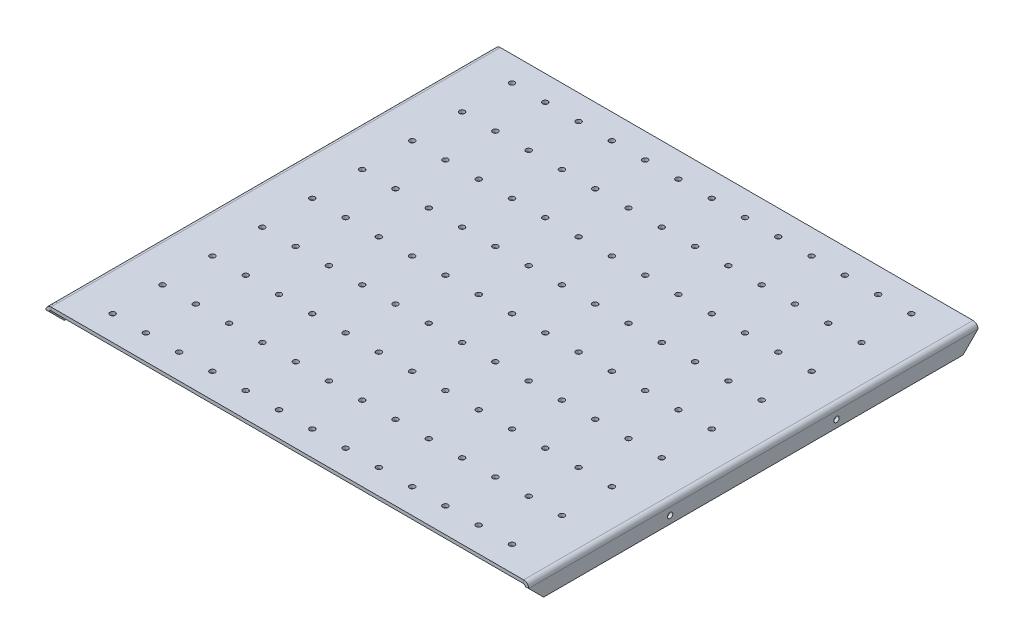
from build123d import *

# Parameters (mm, degrees)
SKETCH1_W                      = 290
SKETCH1_H                      = 270
SKETCH1_R                      = 1.6
BOSS_EXTRUDE1_DEPTH            = 2
EDGE_FLANGE1_STRIP_W           = 10
EDGE_FLANGE1_STRIP_H           = 2
EDGE_FLANGE1_STRIP_CUT_DEPTH   = 270
EDGE_FLANGE1_STRIP_2_W         = 10
EDGE_FLANGE1_STRIP_2_H         = 2
EDGE_FLANGE1_STRIP_CUT_2_DEPTH = 270
EDGE_FLANGE1_DEPTH             = 270
EDGE_FLANGE1_BEND_DEPTH        = 270
SKETCH12_R                     = 1.6
CUT_EXTRUDE1_DEPTH             = 321.039060116
CHAMFER1_SIZE                  = 9


# Sheet-metal steps are written as plain solids
with BuildPart() as part:
    # Sketch1 → Boss-Extrude1 (new body)
    with BuildSketch(Plane(origin=(0, 0, 0), x_dir=(1, 0, 0), z_dir=(0, 1, 0))):
        Rectangle(SKETCH1_W, SKETCH1_H)
        with Locations(Location((-120, 120, 0), (0, 0, 270))):
            Circle(SKETCH1_R, mode=Mode.SUBTRACT)
        with Locations(Location((-100, 120, 0), (0, 0, 270))):
            Circle(SKETCH1_R, mode=Mode.SUBTRACT)
        with Locations(Location((-80, 120, 0), (0, 0, 270))):
            Circle(SKETCH1_R, mode=Mode.SUBTRACT)
        with Locations(Location((-60, 120, 0), (0, 0, 270))):
            Circle(SKETCH1_R, mode=Mode.SUBTRACT)
        with Locations(Location((-40, 120, 0), (0, 0, 270))):
            Circle(SKETCH1_R, mode=Mode.SUBTRACT)
        with Locations(Location((-20, 120, 0), (0, 0, 270))):
            Circle(SKETCH1_R, mode=Mode.SUBTRACT)
        with Locations(Location((0, 120, 0), (0, 0, 270))):
            Circle(SKETCH1_R, mode=Mode.SUBTRACT)
        with Locations(Location((20, 120, 0), (0, 0, 270))):
            Circle(SKETCH1_R, mode=Mode.SUBTRACT)
        with Locations(Location((40, 120, 0), (0, 0, 270))):
            Circle(SKETCH1_R, mode=Mode.SUBTRACT)
        with Locations(Location((60, 120, 0), (0, 0, 270))):
            Circle(SKETCH1_R, mode=Mode.SUBTRACT)
        with Locations(Location((80, 120, 0), (0, 0, 270))):
            Circle(SKETCH1_R, mode=Mode.SUBTRACT)
        with Locations(Location((100, 120, 0), (0, 0, 270))):
            Circle(SKETCH1_R, mode=Mode.SUBTRACT)
        with Locations(Location((120, 120, 0), (0, 0, 270))):
            Circle(SKETCH1_R, mode=Mode.SUBTRACT)
        with Locations(Location((-100, 90, 0), (0, 0, 270))):
            Circle(SKETCH1_R, mode=Mode.SUBTRACT)
        with Locations(Location((-80, 90, 0), (0, 0, 270))):
            Circle(SKETCH1_R, mode=Mode.SUBTRACT)
        with Locations(Location((-60, 90, 0), (0, 0, 270))):
            Circle(SKETCH1_R, mode=Mode.SUBTRACT)
        with Locations(Location((-40, 90, 0), (0, 0, 270))):
            Circle(SKETCH1_R, mode=Mode.SUBTRACT)
        with Locations(Location((-20, 90, 0), (0, 0, 270))):
            Circle(SKETCH1_R, mode=Mode.SUBTRACT)
        with Locations(Location((0, 90, 0), (0, 0, 270))):
            Circle(SKETCH1_R, mode=Mode.SUBTRACT)
        with Locations(Location((20, 90, 0), (0, 0, 270))):
            Circle(SKETCH1_R, mode=Mode.SUBTRACT)
        with Locations(Location((40, 90, 0), (0, 0, 270))):
            Circle(SKETCH1_R, mode=Mode.SUBTRACT)
        with Locations(Location((60, 90, 0), (0, 0, 270))):
            Circle(SKETCH1_R, mode=Mode.SUBTRACT)
        with Locations(Location((80, 90, 0), (0, 0, 270))):
            Circle(SKETCH1_R, mode=Mode.SUBTRACT)
        with Locations(Location((100, 90, 0), (0, 0, 270))):
            Circle(SKETCH1_R, mode=Mode.SUBTRACT)
        with Locations(Location((120, 90, 0), (0, 0, 270))):
            Circle(SKETCH1_R, mode=Mode.SUBTRACT)
        with Locations(Location((-100, 60, 0), (0, 0, 270))):
            Circle(SKETCH1_R, mode=Mode.SUBTRACT)
        with Locations(Location((-80, 60, 0), (0, 0, 270))):
            Circle(SKETCH1_R, mode=Mode.SUBTRACT)
        with Locations(Location((-60, 60, 0), (0, 0, 270))):
            Circle(SKETCH1_R, mode=Mode.SUBTRACT)
        with Locations(Location((-40, 60, 0), (0, 0, 270))):
            Circle(SKETCH1_R, mode=Mode.SUBTRACT)
        with Locations(Location((-20, 60, 0), (0, 0, 270))):
            Circle(SKETCH1_R, mode=Mode.SUBTRACT)
        with Locations(Location((0, 60, 0), (0, 0, 270))):
            Circle(SKETCH1_R, mode=Mode.SUBTRACT)
        with Locations(Location((20, 60, 0), (0, 0, 270))):
            Circle(SKETCH1_R, mode=Mode.SUBTRACT)
        with Locations(Location((40, 60, 0), (0, 0, 270))):
            Circle(SKETCH1_R, mode=Mode.SUBTRACT)
        with Locations(Location((60, 60, 0), (0, 0, 270))):
            Circle(SKETCH1_R, mode=Mode.SUBTRACT)
        with Locations(Location((80, 60, 0), (0, 0, 270))):
            Circle(SKETCH1_R, mode=Mode.SUBTRACT)
        with Locations(Location((100, 60, 0), (0, 0, 270))):
            Circle(SKETCH1_R, mode=Mode.SUBTRACT)
        with Locations(Location((120, 60, 0), (0, 0, 270))):
            Circle(SKETCH1_R, mode=Mode.SUBTRACT)
        with Locations(Location((-100, 30, 0), (0, 0, 270))):
            Circle(SKETCH1_R, mode=Mode.SUBTRACT)
        with Locations(Location((-80, 30, 0), (0, 0, 270))):
            Circle(SKETCH1_R, mode=Mode.SUBTRACT)
        with Locations(Location((-60, 30, 0), (0, 0, 270))):
            Circle(SKETCH1_R, mode=Mode.SUBTRACT)
        with Locations(Location((-40, 30, 0), (0, 0, 270))):
            Circle(SKETCH1_R, mode=Mode.SUBTRACT)
        with Locations(Location((-20, 30, 0), (0, 0, 270))):
            Circle(SKETCH1_R, mode=Mode.SUBTRACT)
        with Locations(Location((0, 30, 0), (0, 0, 270))):
            Circle(SKETCH1_R, mode=Mode.SUBTRACT)
        with Locations(Location((20, 30, 0), (0, 0, 270))):
            Circle(SKETCH1_R, mode=Mode.SUBTRACT)
        with Locations(Location((40, 30, 0), (0, 0, 270))):
            Circle(SKETCH1_R, mode=Mode.SUBTRACT)
        with Locations(Location((60, 30, 0), (0, 0, 270))):
            Circle(SKETCH1_R, mode=Mode.SUBTRACT)
        with Locations(Location((80, 30, 0), (0, 0, 270))):
            Circle(SKETCH1_R, mode=Mode.SUBTRACT)
        with Locations(Location((100, 30, 0), (0, 0, 270))):
            Circle(SKETCH1_R, mode=Mode.SUBTRACT)
        with Locations(Location((120, 30, 0), (0, 0, 270))):
            Circle(SKETCH1_R, mode=Mode.SUBTRACT)
        with Locations(Location((-120, 90, 0), (0, 0, 270))):
            Circle(SKETCH1_R, mode=Mode.SUBTRACT)
        with Locations(Location((-120, 60, 0), (0, 0, 270))):
            Circle(SKETCH1_R, mode=Mode.SUBTRACT)
        with Locations(Location((-120, 30, 0), (0, 0, 270))):
            Circle(SKETCH1_R, mode=Mode.SUBTRACT)
        with Locations(Location((-120, 0, 0), (0, 0, 270))):
            Circle(SKETCH1_R, mode=Mode.SUBTRACT)
        with Locations(Location((-100, 0, 0), (0, 0, 270))):
            Circle(SKETCH1_R, mode=Mode.SUBTRACT)
        with Locations(Location((-80, 0, 0), (0, 0, 270))):
            Circle(SKETCH1_R, mode=Mode.SUBTRACT)
        with Locations(Location((-60, 0, 0), (0, 0, 270))):
            Circle(SKETCH1_R, mode=Mode.SUBTRACT)
        with Locations(Location((-40, 0, 0), (0, 0, 270))):
            Circle(SKETCH1_R, mode=Mode.SUBTRACT)
        with Locations(Location((-20, 0, 0), (0, 0, 270))):
            Circle(SKETCH1_R, mode=Mode.SUBTRACT)
        with Locations(Location((0, 0, 0), (0, 0, 270))):
            Circle(SKETCH1_R, mode=Mode.SUBTRACT)
        with Locations(Location((20, 0, 0), (0, 0, 270))):
            Circle(SKETCH1_R, mode=Mode.SUBTRACT)
        with Locations(Location((40, 0, 0), (0, 0, 270))):
            Circle(SKETCH1_R, mode=Mode.SUBTRACT)
        with Locations(Location((60, 0, 0), (0, 0, 270))):
            Circle(SKETCH1_R, mode=Mode.SUBTRACT)
        with Locations(Location((80, 0, 0), (0, 0, 270))):
            Circle(SKETCH1_R, mode=Mode.SUBTRACT)
        with Locations(Location((100, 0, 0), (0, 0, 270))):
            Circle(SKETCH1_R, mode=Mode.SUBTRACT)
        with Locations(Location((120, 0, 0), (0, 0, 270))):
            Circle(SKETCH1_R, mode=Mode.SUBTRACT)
        with Locations(Location((-120, -30, 0), (0, 0, 270))):
            Circle(SKETCH1_R, mode=Mode.SUBTRACT)
        with Locations(Location((-100, -30, 0), (0, 0, 270))):
            Circle(SKETCH1_R, mode=Mode.SUBTRACT)
        with Locations(Location((-80, -30, 0), (0, 0, 270))):
            Circle(SKETCH1_R, mode=Mode.SUBTRACT)
        with Locations(Location((-60, -30, 0), (0, 0, 270))):
            Circle(SKETCH1_R, mode=Mode.SUBTRACT)
        with Locations(Location((-40, -30, 0), (0, 0, 270))):
            Circle(SKETCH1_R, mode=Mode.SUBTRACT)
        with Locations(Location((-20, -30, 0), (0, 0, 270))):
            Circle(SKETCH1_R, mode=Mode.SUBTRACT)
        with Locations(Location((0, -30, 0), (0, 0, 270))):
            Circle(SKETCH1_R, mode=Mode.SUBTRACT)
        with Locations(Location((20, -30, 0), (0, 0, 270))):
            Circle(SKETCH1_R, mode=Mode.SUBTRACT)
        with Locations(Location((40, -30, 0), (0, 0, 270))):
            Circle(SKETCH1_R, mode=Mode.SUBTRACT)
        with Locations(Location((60, -30, 0), (0, 0, 270))):
            Circle(SKETCH1_R, mode=Mode.SUBTRACT)
        with Locations(Location((80, -30, 0), (0, 0, 270))):
            Circle(SKETCH1_R, mode=Mode.SUBTRACT)
        with Locations(Location((100, -30, 0), (0, 0, 270))):
            Circle(SKETCH1_R, mode=Mode.SUBTRACT)
        with Locations(Location((120, -30, 0), (0, 0, 270))):
            Circle(SKETCH1_R, mode=Mode.SUBTRACT)
        with Locations(Location((-120, -60, 0), (0, 0, 270))):
            Circle(SKETCH1_R, mode=Mode.SUBTRACT)
        with Locations(Location((-100, -60, 0), (0, 0, 270))):
            Circle(SKETCH1_R, mode=Mode.SUBTRACT)
        with Locations(Location((-80, -60, 0), (0, 0, 270))):
            Circle(SKETCH1_R, mode=Mode.SUBTRACT)
        with Locations(Location((-60, -60, 0), (0, 0, 270))):
            Circle(SKETCH1_R, mode=Mode.SUBTRACT)
        with Locations(Location((-40, -60, 0), (0, 0, 270))):
            Circle(SKETCH1_R, mode=Mode.SUBTRACT)
        with Locations(Location((-20, -60, 0), (0, 0, 270))):
            Circle(SKETCH1_R, mode=Mode.SUBTRACT)
        with Locations(Location((0, -60, 0), (0, 0, 270))):
            Circle(SKETCH1_R, mode=Mode.SUBTRACT)
        with Locations(Location((20, -60, 0), (0, 0, 270))):
            Circle(SKETCH1_R, mode=Mode.SUBTRACT)
        with Locations(Location((40, -60, 0), (0, 0, 270))):
            Circle(SKETCH1_R, mode=Mode.SUBTRACT)
        with Locations(Location((60, -60, 0), (0, 0, 270))):
            Circle(SKETCH1_R, mode=Mode.SUBTRACT)
        with Locations(Location((80, -60, 0), (0, 0, 270))):
            Circle(SKETCH1_R, mode=Mode.SUBTRACT)
        with Locations(Location((100, -60, 0), (0, 0, 270))):
            Circle(SKETCH1_R, mode=Mode.SUBTRACT)
        with Locations(Location((120, -60, 0), (0, 0, 270))):
            Circle(SKETCH1_R, mode=Mode.SUBTRACT)
        with Locations(Location((-120, -90, 0), (0, 0, 270))):
            Circle(SKETCH1_R, mode=Mode.SUBTRACT)
        with Locations(Location((-100, -90, 0), (0, 0, 270))):
            Circle(SKETCH1_R, mode=Mode.SUBTRACT)
        with Locations(Location((-80, -90, 0), (0, 0, 270))):
            Circle(SKETCH1_R, mode=Mode.SUBTRACT)
        with Locations(Location((-60, -90, 0), (0, 0, 270))):
            Circle(SKETCH1_R, mode=Mode.SUBTRACT)
        with Locations(Location((-40, -90, 0), (0, 0, 270))):
            Circle(SKETCH1_R, mode=Mode.SUBTRACT)
        with Locations(Location((-20, -90, 0), (0, 0, 270))):
            Circle(SKETCH1_R, mode=Mode.SUBTRACT)
        with Locations(Location((0, -90, 0), (0, 0, 270))):
            Circle(SKETCH1_R, mode=Mode.SUBTRACT)
        with Locations(Location((20, -90, 0), (0, 0, 270))):
            Circle(SKETCH1_R, mode=Mode.SUBTRACT)
        with Locations(Location((40, -90, 0), (0, 0, 270))):
            Circle(SKETCH1_R, mode=Mode.SUBTRACT)
        with Locations(Location((60, -90, 0), (0, 0, 270))):
            Circle(SKETCH1_R, mode=Mode.SUBTRACT)
        with Locations(Location((80, -90, 0), (0, 0, 270))):
            Circle(SKETCH1_R, mode=Mode.SUBTRACT)
        with Locations(Location((100, -90, 0), (0, 0, 270))):
            Circle(SKETCH1_R, mode=Mode.SUBTRACT)
        with Locations(Location((120, -90, 0), (0, 0, 270))):
            Circle(SKETCH1_R, mode=Mode.SUBTRACT)
        with Locations(Location((-120, -120, 0), (0, 0, 270))):
            Circle(SKETCH1_R, mode=Mode.SUBTRACT)
        with Locations(Location((-100, -120, 0), (0, 0, 270))):
            Circle(SKETCH1_R, mode=Mode.SUBTRACT)
        with Locations(Location((-80, -120, 0), (0, 0, 270))):
            Circle(SKETCH1_R, mode=Mode.SUBTRACT)
        with Locations(Location((-60, -120, 0), (0, 0, 270))):
            Circle(SKETCH1_R, mode=Mode.SUBTRACT)
        with Locations(Location((-40, -120, 0), (0, 0, 270))):
            Circle(SKETCH1_R, mode=Mode.SUBTRACT)
        with Locations(Location((-20, -120, 0), (0, 0, 270))):
            Circle(SKETCH1_R, mode=Mode.SUBTRACT)
        with Locations(Location((0, -120, 0), (0, 0, 270))):
            Circle(SKETCH1_R, mode=Mode.SUBTRACT)
        with Locations(Location((20, -120, 0), (0, 0, 270))):
            Circle(SKETCH1_R, mode=Mode.SUBTRACT)
        with Locations(Location((40, -120, 0), (0, 0, 270))):
            Circle(SKETCH1_R, mode=Mode.SUBTRACT)
        with Locations(Location((60, -120, 0), (0, 0, 270))):
            Circle(SKETCH1_R, mode=Mode.SUBTRACT)
        with Locations(Location((80, -120, 0), (0, 0, 270))):
            Circle(SKETCH1_R, mode=Mode.SUBTRACT)
        with Locations(Location((100, -120, 0), (0, 0, 270))):
            Circle(SKETCH1_R, mode=Mode.SUBTRACT)
        with Locations(Location((120, -120, 0), (0, 0, 270))):
            Circle(SKETCH1_R, mode=Mode.SUBTRACT)
    extrude(amount=BOSS_EXTRUDE1_DEPTH)

    # Edge-Flange1 strip (across the edge) → Edge-Flange1 strip cut (cut)
    with BuildSketch(Plane(origin=(-145, 0, 135), x_dir=(1, 0, 0), z_dir=(0, 0, -1))):
        with Locations((-2, -1)):
            Rectangle(EDGE_FLANGE1_STRIP_W, EDGE_FLANGE1_STRIP_H)
    extrude(amount=EDGE_FLANGE1_STRIP_CUT_DEPTH, mode=Mode.SUBTRACT)

    # Edge-Flange1 strip 2 (across the edge) → Edge-Flange1 strip cut 2 (cut)
    with BuildSketch(Plane(origin=(145, 0, -135), x_dir=(-1, 0, 0), z_dir=(0, 0, 1))):
        with Locations((-2, -1)):
            Rectangle(EDGE_FLANGE1_STRIP_2_W, EDGE_FLANGE1_STRIP_2_H)
    extrude(amount=EDGE_FLANGE1_STRIP_CUT_2_DEPTH, mode=Mode.SUBTRACT)

    # Edge-Flange1 section (across the edge) → Edge-Flange1 (add)
    with BuildSketch(Plane(origin=(-145, 0, 135), x_dir=(1, 0, 0), z_dir=(0, 0, -1))):
        with BuildLine():
            Line((0, 1), (0, 10))
            Line((0, 10), (2, 10))
            Line((2, 10), (2, 1))
            ThreePointArc((2, 1), (2.292893219, 0.292893219), (3, 0))
            Line((3, 0), (3, -2))
            ThreePointArc((3, -2), (0.878679656, -1.121320344), (0, 1))
        make_face()
    extrude(amount=EDGE_FLANGE1_DEPTH)

    # Edge-Flange1 section 2 (across the edge) → Edge-Flange1 bend (add)
    with BuildSketch(Plane(origin=(145, 0, -135), x_dir=(-1, 0, 0), z_dir=(0, 0, 1))):
        with BuildLine():
            Line((0, 1), (0, 10))
            Line((0, 10), (2, 10))
            Line((2, 10), (2, 1))
            ThreePointArc((2, 1), (2.292893219, 0.292893219), (3, 0))
            Line((3, 0), (3, -2))
            ThreePointArc((3, -2), (0.878679656, -1.121320344), (0, 1))
        make_face()
    extrude(amount=EDGE_FLANGE1_BEND_DEPTH)

    # Sketch12 → Cut-Extrude1 (cut, through all)
    with BuildSketch(Plane.ZY.offset(145)):
        with Locations(Location((-50, -5.5, 0), (0, 0, 270))):
            Circle(SKETCH12_R)
        with Locations(Location((50, -5.5, 0), (0, 0, 270))):
            Circle(SKETCH12_R)
    extrude(amount=-CUT_EXTRUDE1_DEPTH, mode=Mode.SUBTRACT)

    # Chamfer1
    chamfer1_edges = [part.edges().sort_by_distance(p)[0] for p in [
        (144, -10, -135),
        (144, -10, 135),
        (-144, -10, 135),
        (-144, -10, -135),
    ]]
    chamfer(chamfer1_edges, length=CHAMFER1_SIZE)


solid = part.part
